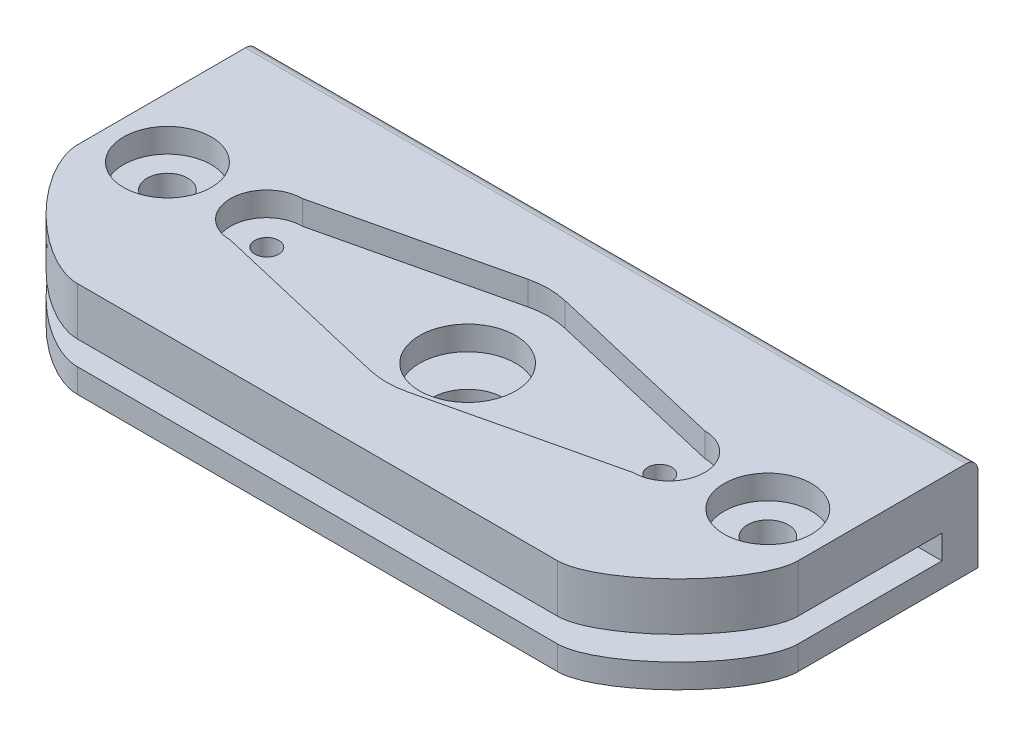
from build123d import *

# Parameters (mm, degrees)
SKETCH1_W           = 60
SKETCH1_H           = 8
BOSS_EXTRUDE1_DEPTH = 25
SKETCH2_W           = 60
SKETCH2_H           = 2
CUT_EXTRUDE1_DEPTH  = 22
CUT_EXTRUDE2_DEPTH  = 2
SKETCH4_R           = 1
SKETCH4_R_2         = 4
CUT_EXTRUDE3_DEPTH  = 2.5
SKETCH5_R           = 1.7
CUT_EXTRUDE4_DEPTH  = 9
FILLET1_R           = 1
FILLET2_SIZE        = 10
SKETCH6_R           = 3
CUT_EXTRUDE5_DEPTH  = 4.5
CUT_EXTRUDE6_DEPTH  = 1
SKETCH8_R           = 3.65
CUT_EXTRUDE7_DEPTH  = 2


with BuildPart() as part:
    # Sketch1 → Boss-Extrude1 (new body)
    with BuildSketch(Plane.XY):
        with Locations((9.92851316, -6.03519833)):
            Rectangle(SKETCH1_W, SKETCH1_H)
    extrude(amount=BOSS_EXTRUDE1_DEPTH)

    # Sketch2 → Cut-Extrude1 (cut)
    with BuildSketch(Plane.XY.offset(25)):
        with Locations((9.92851316, -7.03519833)):
            Rectangle(SKETCH2_W, SKETCH2_H)
    extrude(amount=-CUT_EXTRUDE1_DEPTH, mode=Mode.SUBTRACT)

    # Sketch3 → Cut-Extrude2 (cut)
    with BuildSketch(Plane(origin=(0, -2.03519833, 0), x_dir=(1, 0, 0), z_dir=(0, 1, 0))):
        with BuildLine():
            Line((26.67851316, -9.5), (11.471726674, -5.928775453))
            ThreePointArc((11.471726674, -5.928775453), (9.92851316, -5.75), (8.385299646, -5.928775453))
            Line((8.385299646, -5.928775453), (-6.82148684, -9.5))
            ThreePointArc((-6.82148684, -9.5), (-9.821486841, -12.5), (-6.82148684, -15.5))
            Line((-6.82148684, -15.5), (8.385299646, -19.071224547))
            ThreePointArc((8.385299646, -19.071224547), (9.92851316, -19.25), (11.471726674, -19.071224547))
            Line((11.471726674, -19.071224547), (26.67851316, -15.5))
            ThreePointArc((26.67851316, -15.5), (29.67851316, -12.5), (26.67851316, -9.5))
        make_face()
    extrude(amount=-CUT_EXTRUDE2_DEPTH, mode=Mode.SUBTRACT)

    # Sketch4 → Cut-Extrude3 (cut)
    with BuildSketch(Plane(origin=(0, -4.03519833, 0), x_dir=(1, 0, 0), z_dir=(0, 1, 0))):
        with Locations(Location((-6.796927173, -12.5, 0), (0, 0, 270))):
            Circle(SKETCH4_R)
        with Locations(Location((9.92851316, -12.5, 0), (0, 0, 270))):
            Circle(SKETCH4_R_2)
        with Locations(Location((25.92851316, -12.5, 0), (0, 0, 270))):
            Circle(SKETCH4_R)
    extrude(amount=-CUT_EXTRUDE3_DEPTH, mode=Mode.SUBTRACT)

    # Sketch5 → Cut-Extrude4 (cut)
    with BuildSketch(Plane(origin=(0, -2.03519833, 0), x_dir=(1, 0, 0), z_dir=(0, 1, 0))):
        with Locations(Location((34.92851316, -12.5, 0), (0, 0, 270))):
            Circle(SKETCH5_R)
        with Locations(Location((-15.07148684, -12.5, 0), (0, 0, 270))):
            Circle(SKETCH5_R)
    extrude(amount=-CUT_EXTRUDE4_DEPTH, mode=Mode.SUBTRACT)

    # Fillet1
    fillet1_edges = [part.edges().sort_by_distance(p)[0] for p in [
        (9.92851316, -2.03519833, 0),
    ]]
    fillet(fillet1_edges, radius=FILLET1_R)

    # Fillet2
    # a fillet whose section is not a circle: 10 mm, written as the material it takes off along each edge
    with BuildSketch(Plane(origin=(-20.07148684, -31.03519833, 25), x_dir=(0, 0, -1), z_dir=(0, 1, 0))) as fillet2_piece_1:
        with BuildLine():
            Bezier((FILLET2_SIZE, 0), (0, 0), (0, -FILLET2_SIZE), weights=[1, 0.353553391, 1])
            Line((0, -FILLET2_SIZE), (0, 0))
            Line((0, 0), (FILLET2_SIZE, 0))
        make_face()
    extrude(amount=54, mode=Mode.SUBTRACT)
    with BuildSketch(Plane(origin=(-20.07148684, -35.03519833, 25), x_dir=(0, 0, -1), z_dir=(0, 1, 0)), Plane(origin=(39.92851316, 16.96480167, 25), x_dir=(0, 0, -1), z_dir=(0, -1, 0))) as fillet2_piece_2:
        with BuildLine():
            Bezier((FILLET2_SIZE, 0), (0, 0), (0, -FILLET2_SIZE), weights=[1, 0.353553391, 1])
            Line((0, -FILLET2_SIZE), (0, 0))
            Line((0, 0), (FILLET2_SIZE, 0))
        make_face()
    extrude(amount=52, mode=Mode.SUBTRACT)
    with BuildSketch(Plane(origin=(39.92851316, 22.96480167, 25), x_dir=(-1, 0, 0), z_dir=(0, -1, 0))) as fillet2_piece_3:
        with BuildLine():
            Bezier((FILLET2_SIZE, 0), (0, 0), (0, FILLET2_SIZE), weights=[1, 0.353553391, 1])
            Line((0, FILLET2_SIZE), (0, 0))
            Line((0, 0), (FILLET2_SIZE, 0))
        make_face()
    extrude(amount=54, mode=Mode.SUBTRACT)

    # Sketch6 → Cut-Extrude5 (cut)
    with BuildSketch(Plane(origin=(0, -8.03519833, 0), x_dir=(1, 0, 0), z_dir=(0, 1, 0))):
        with Locations(Location((9.92851316, -12.5, 0), (0, 0, 270))):
            Circle(SKETCH6_R)
    extrude(amount=-CUT_EXTRUDE5_DEPTH, mode=Mode.SUBTRACT)

    # Sketch7 → Cut-Extrude6 (cut)
    with BuildSketch(Plane(origin=(0, -10.03519833, 0), x_dir=(-1, 0, 0), z_dir=(0, -1, 0))):
        Polygon((-35.683884991, -9.237677709), (-38.131453055, -11.52301005), (-37.376081224, -14.785332341), (-34.173141329, -15.762322291), (-31.725573265, -13.47698995), (-32.480945096, -10.214667659), align=None)
        Polygon((12.105656047, -10.945271393), (12.242136974, -14.291120506), (15.207967766, -15.845849113), (18.037317633, -14.054728607), (17.900836706, -10.708879494), (14.935005914, -9.154150887), align=None)
    extrude(amount=-CUT_EXTRUDE6_DEPTH, mode=Mode.SUBTRACT)

    # Sketch8 → Cut-Extrude7 (cut)
    with BuildSketch(Plane(origin=(0, -2.03519833, 0), x_dir=(1, 0, 0), z_dir=(0, 1, 0))):
        with Locations(Location((-15.07148684, -12.5, 0), (0, 0, 270))):
            Circle(SKETCH8_R)
        with Locations(Location((34.92851316, -12.5, 0), (0, 0, 270))):
            Circle(SKETCH8_R)
    extrude(amount=-CUT_EXTRUDE7_DEPTH, mode=Mode.SUBTRACT)


solid = part.part
